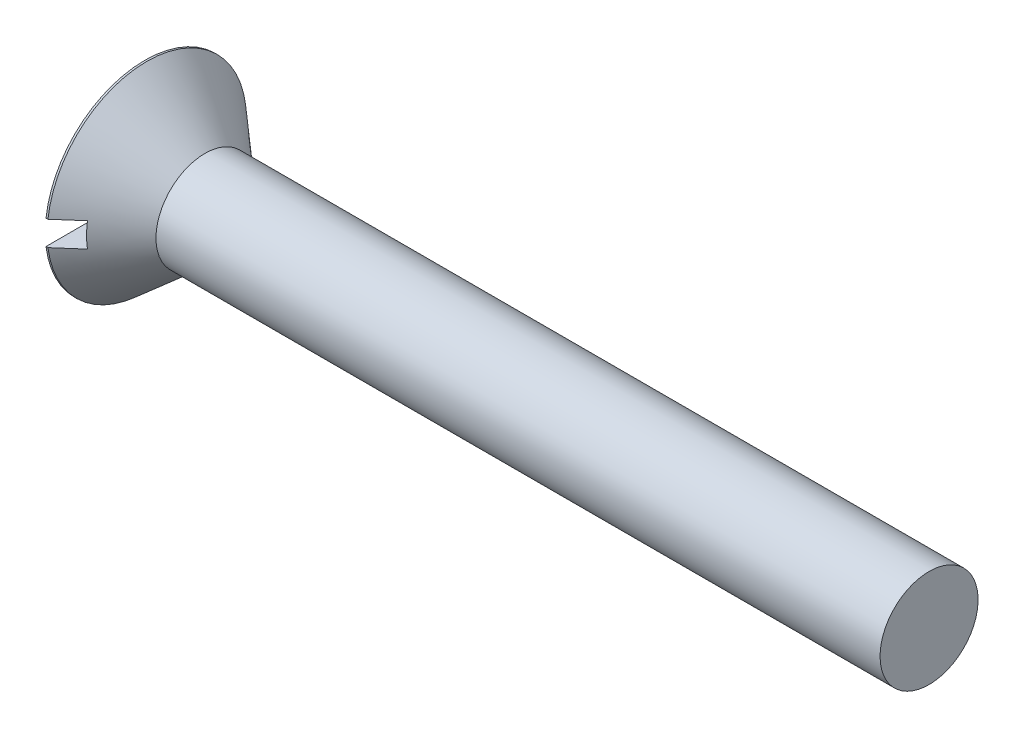
from build123d import *

# Parameters (mm, degrees)
SKETCH6_W  = 19.3548
SKETCH6_H  = 2.3876
SLOT_DEPTH = 2.2352


with BuildPart() as part:
    # BodySke → Base-Revolve (revolve)
    with BuildSketch(Plane.XY):
        Polygon((0, 0), (0, 9.6774), (0.188054315, 9.6774), (5.842, 4.7625), (76.2, 4.7625), (76.2, 0), align=None)
    revolve(axis=Axis((-6.35, 0, 0), (1, 0, 0)))

    # Sketch6 → Slot (cut)
    with BuildSketch(Plane.ZY):
        Rectangle(SKETCH6_W, SKETCH6_H)
    extrude(amount=-SLOT_DEPTH, mode=Mode.SUBTRACT)


solid = part.part
